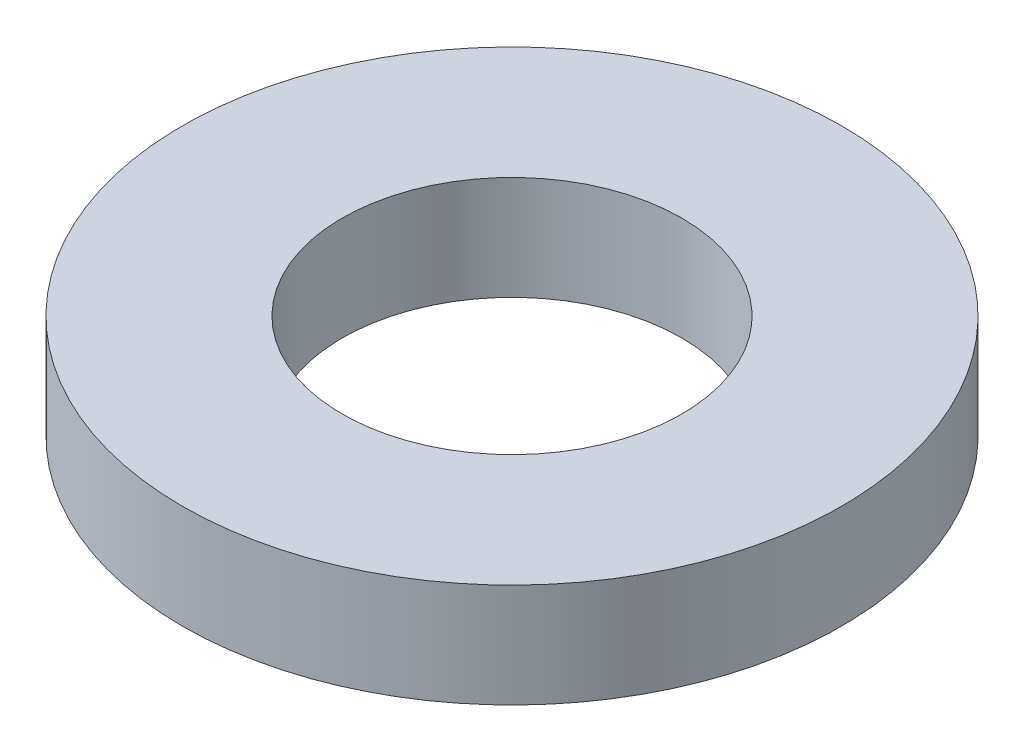
from build123d import *

# Parameters (mm, degrees)
SKETCH1_R           = 82.5
BOSS_EXTRUDE1_DEPTH = 26
SKETCH2_R           = 42.5
CUT_EXTRUDE1_DEPTH  = 120.534513844


with BuildPart() as part:
    # Sketch1 → Boss-Extrude1 (new body)
    with BuildSketch(Plane(origin=(0, 0, 0), x_dir=(1, 0, 0), z_dir=(0, 1, 0))):
        Circle(SKETCH1_R)
    extrude(amount=BOSS_EXTRUDE1_DEPTH)

    # Sketch2 → Cut-Extrude1 (cut, through all)
    with BuildSketch(Plane(origin=(0, 0, 0), x_dir=(1, 0, 0), z_dir=(0, 1, 0))):
        Circle(SKETCH2_R)
    extrude(amount=CUT_EXTRUDE1_DEPTH, mode=Mode.SUBTRACT)


solid = part.part
